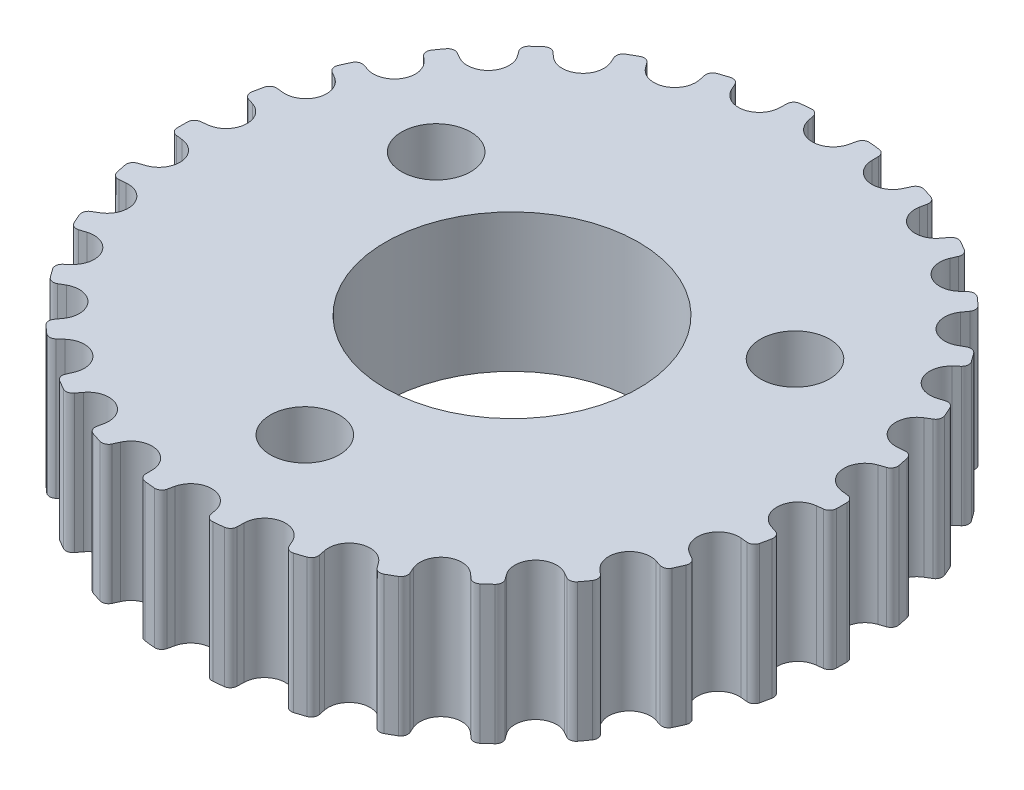
from build123d import *

# Parameters (mm, degrees)
SKETCH1_R           = 14.323944878
BOSS_EXTRUDE1_DEPTH = 6
CUT_EXTRUDE1_DEPTH  = 22.127015732
CIRPATTERN1_COUNT   = 30
SKETCH3_R           = 5.5
CUT_EXTRUDE2_DEPTH  = 22.08964236
SKETCH4_R           = 1.5
CUT_EXTRUDE3_DEPTH  = 22.08964236


with BuildPart() as part:
    # Sketch1 → Boss-Extrude1 (new body)
    with BuildSketch(Plane(origin=(0, 0, 0), x_dir=(1, 0, 0), z_dir=(0, 1, 0))):
        Circle(SKETCH1_R)
    extrude(amount=BOSS_EXTRUDE1_DEPTH)

    # Sketch2 → Cut-Extrude1 (cut, through all)
    with BuildSketch(Plane(origin=(0, 6, 0), x_dir=(1, 0, 0), z_dir=(0, 1, 0))):
        with BuildLine():
            Line((-0.88830444, 13.756422166), (-0.95, 14.033881093))
            ThreePointArc((-0.95, 14.033881093), (-1.065709647, 14.210883809), (-1.269434594, 14.267583281))
            ThreePointArc((-1.269434594, 14.267583281), (-2.127648488, 14.165045315), (-2.978115599, 14.010932316))
            Line((-2.978115599, 14.010932316), (-2.978115599, 14.323944878))
            Line((-2.978115599, 14.323944878), (2.978115599, 14.323944878))
            Line((2.978115599, 14.323944878), (2.978115599, 14.010932316))
            ThreePointArc((2.978115599, 14.010932316), (2.127648488, 14.165045315), (1.269434594, 14.267583281))
            ThreePointArc((1.269434594, 14.267583281), (1.065709647, 14.210883809), (0.95, 14.033881093))
            Line((0.95, 14.033881093), (0.88830444, 13.756422166))
            ThreePointArc((0.88830444, 13.756422166), (0, 13.043944878), (-0.88830444, 13.756422166))
        make_face()
    cut_extrude1 = extrude(amount=-CUT_EXTRUDE1_DEPTH, mode=Mode.SUBTRACT)

    # CirPattern1: Cut-Extrude1 ×30 about axis
    cirpattern1_axis = Axis((0, 6, 0), (0, -1, 0))
    for i in range(1, CIRPATTERN1_COUNT):
        add(cut_extrude1.rotate(cirpattern1_axis, i * 360 / CIRPATTERN1_COUNT), mode=Mode.SUBTRACT)

    # Sketch3 → Cut-Extrude2 (cut, through all)
    with BuildSketch(Plane.XZ):
        Circle(SKETCH3_R)
    extrude(amount=-CUT_EXTRUDE2_DEPTH, mode=Mode.SUBTRACT)

    # Sketch4 → Cut-Extrude3 (cut, through all)
    with BuildSketch(Plane.XZ):
        with Locations((0, 9)):
            Circle(SKETCH4_R)
        with Locations((7.794228634, -4.5)):
            Circle(SKETCH4_R)
        with Locations((-7.794228634, -4.5)):
            Circle(SKETCH4_R)
    extrude(amount=-CUT_EXTRUDE3_DEPTH, mode=Mode.SUBTRACT)


solid = part.part
